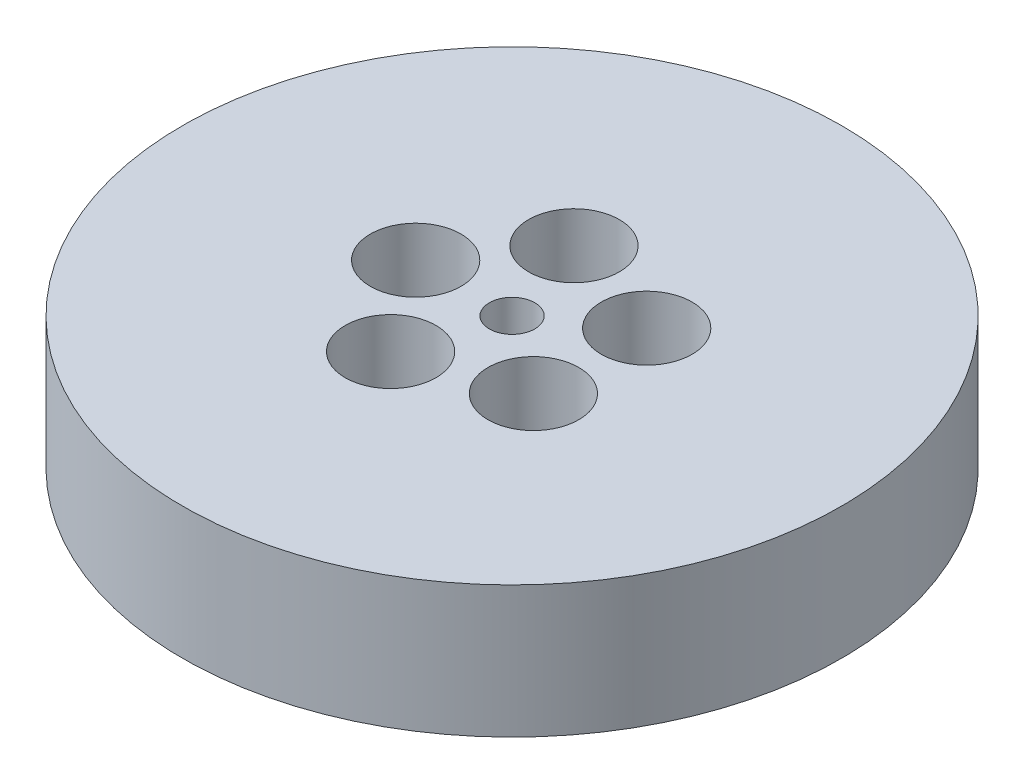
from build123d import *

# Parameters (mm, degrees)
SKETCH1_R           = 72.5
BOSS_EXTRUDE1_DEPTH = 29
SKETCH2_R           = 5
CUT_EXTRUDE1_DEPTH  = 107.552803811
SKETCH3_R           = 9.978301822
CUT_EXTRUDE2_DEPTH  = 28.596970923
CIRPATTERN1_COUNT   = 5


with BuildPart() as part:
    # Sketch1 → Boss-Extrude1 (new body)
    with BuildSketch(Plane(origin=(0, 0, 0), x_dir=(1, 0, 0), z_dir=(0, 1, 0))):
        Circle(SKETCH1_R)
    extrude(amount=BOSS_EXTRUDE1_DEPTH)

    # Sketch2 → Cut-Extrude1 (cut, through all)
    with BuildSketch(Plane(origin=(0, 0, 0), x_dir=(1, 0, 0), z_dir=(0, 1, 0))):
        Circle(SKETCH2_R)
    extrude(amount=CUT_EXTRUDE1_DEPTH, mode=Mode.SUBTRACT)

    # Sketch3 → Cut-Extrude2 (cut)
    with BuildSketch(Plane(origin=(0, 29, 0), x_dir=(1, 0, 0), z_dir=(0, 1, 0))):
        with Locations((-21.20509972, 0)):
            Circle(SKETCH3_R)
    cut_extrude2 = extrude(amount=-CUT_EXTRUDE2_DEPTH, mode=Mode.SUBTRACT)

    # CirPattern1: Cut-Extrude2 ×5 about axis
    cirpattern1_axis = Axis((0, 0, 0), (0, 1, 0))
    for i in range(1, CIRPATTERN1_COUNT):
        add(cut_extrude2.rotate(cirpattern1_axis, i * 360 / CIRPATTERN1_COUNT), mode=Mode.SUBTRACT)


solid = part.part
